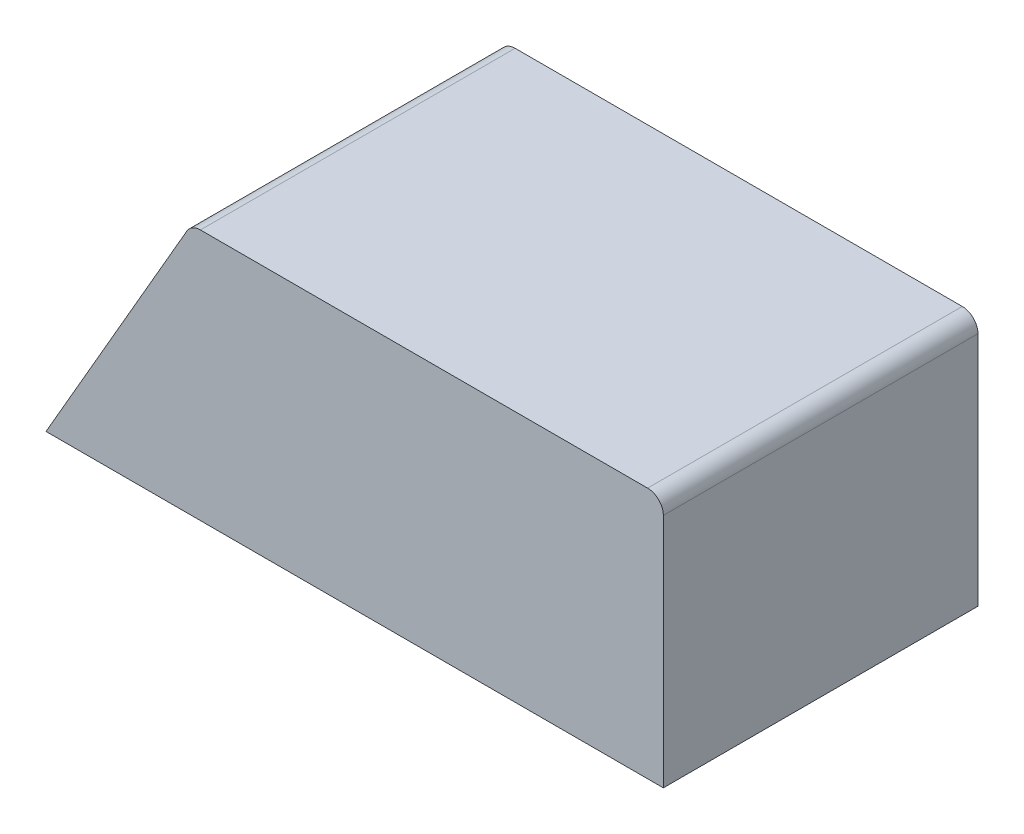
from build123d import *

# Parameters (mm, degrees)
BOSS_EXTRU_1_DEPTH = 5
CONG_1_R           = 0.5


with BuildPart() as part:
    # Esquisse1 → Boss.-Extru.1 (new, symmetric)
    with BuildSketch(Plane.XY):
        Polygon((-15, 8), (0, 8), (0, 0), (-19.618802154, 0), align=None)
    extrude(amount=BOSS_EXTRU_1_DEPTH, both=True)

    # Congé1
    cong_1_edges = [part.edges().sort_by_distance(p)[0] for p in [
        (0, 8, 0),
        (-15, 8, 0),
    ]]
    fillet(cong_1_edges, radius=CONG_1_R)


solid = part.part
